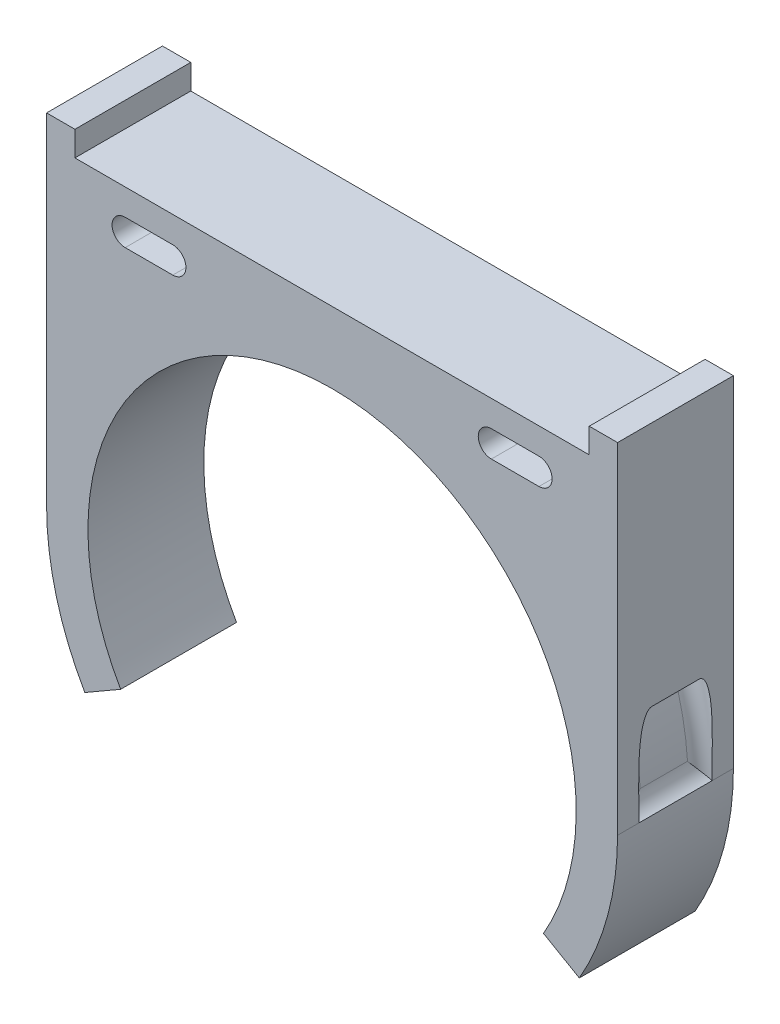
from build123d import *

# Parameters (mm, degrees)
BOSS_EXTRUDE2_DEPTH      = 7
CORTAR_REVOLUCI_N1_ANGLE = 180
REDONDEO1_START          = -5
REDONDEO1_DEPTH          = 10


with BuildPart() as part:
    # Sketch1 → Boss-Extrude2 (new, symmetric)
    with BuildSketch(Plane.XY):
        with BuildLine():
            Line((25.547749412, -14.75), (29.877876431, -17.25))
            ThreePointArc((29.877876431, -17.25), (33.324441007, -8.929257056), (34.5, 0))
            Line((34.5, 0), (34.5, 41.1))
            Line((34.5, 41.1), (31.075, 41.1))
            Line((31.075, 41.1), (31.075, 38.1))
            Line((31.075, 38.1), (-31.075, 38.1))
            Line((-31.075, 38.1), (-31.075, 41.1))
            Line((-31.075, 41.1), (-34.5, 41.1))
            Line((-34.5, 41.1), (-34.5, 0))
            ThreePointArc((-34.5, 0), (-33.324441007, -8.929257056), (-29.877876431, -17.25))
            Line((-29.877876431, -17.25), (-25.547749412, -14.75))
            ThreePointArc((-25.547749412, -14.75), (0, 29.5), (25.547749412, -14.75))
        make_face()
        with BuildLine():
            Line((-25, 34.925), (-19.25, 34.925))
            ThreePointArc((-19.25, 34.925), (-17.6625, 33.3375), (-19.25, 31.75))
            Line((-19.25, 31.75), (-25, 31.75))
            ThreePointArc((-25, 31.75), (-26.5875, 33.3375), (-25, 34.925))
        make_face(mode=Mode.SUBTRACT)
        with BuildLine():
            Line((19.25, 34.925), (25, 34.925))
            ThreePointArc((25, 34.925), (26.5875, 33.3375), (25, 31.75))
            Line((25, 31.75), (19.25, 31.75))
            ThreePointArc((19.25, 31.75), (17.6625, 33.3375), (19.25, 34.925))
        make_face(mode=Mode.SUBTRACT)
    extrude(amount=BOSS_EXTRUDE2_DEPTH, both=True)

    # Croquis1 → Cortar-Revolución1 (revolve, symmetric, cut)
    with BuildSketch(Plane(origin=(0, 0, 0), x_dir=(0, 0, -1), z_dir=(1, 0, 0))) as cortar_revoluci_n1_sk:
        with BuildLine():
            Line((-2.8575, 36.3375), (2.8575, 36.3375))
            ThreePointArc((2.8575, 36.3375), (4.445, 34.75), (2.8575, 33.1625))
            Line((2.8575, 33.1625), (-2.8575, 33.1625))
            ThreePointArc((-2.8575, 33.1625), (-4.445, 34.75), (-2.8575, 36.3375))
        make_face()
    revolve(axis=Axis((0, 0, 0), (0, 0, 1)), revolution_arc=CORTAR_REVOLUCI_N1_ANGLE / 2, mode=Mode.SUBTRACT)
    revolve(cortar_revoluci_n1_sk.sketch, axis=Axis((0, 0, 0), (0, 0, -1)), revolution_arc=CORTAR_REVOLUCI_N1_ANGLE / 2, mode=Mode.SUBTRACT)

    # Redondeo1: read off the stored shape, not the designer's step
    # Redondeo1 outline → Redondeo1 (add)
    with BuildSketch(Plane.XY.offset(REDONDEO1_START)):
        with BuildLine():
            ThreePointArc((34.5, 0), (33.514807302, 0.868494137), (33.095116255, 2.112980435))
            ThreePointArc((33.095116255, 2.112980435), (33.145649783, 1.057027304), (33.1625, 0))
            Line((33.1625, 0), (34.5, 0))
        make_face()
        with BuildLine():
            ThreePointArc((-33.095116255, 2.112980435), (-33.514807302, 0.868494137), (-34.5, 0))
            Line((-34.5, 0), (-33.1625, 0))
            ThreePointArc((-33.1625, 0), (-33.145649783, 1.057027304), (-33.095116255, 2.112980435))
        make_face()
    extrude(amount=REDONDEO1_DEPTH)


solid = part.part
